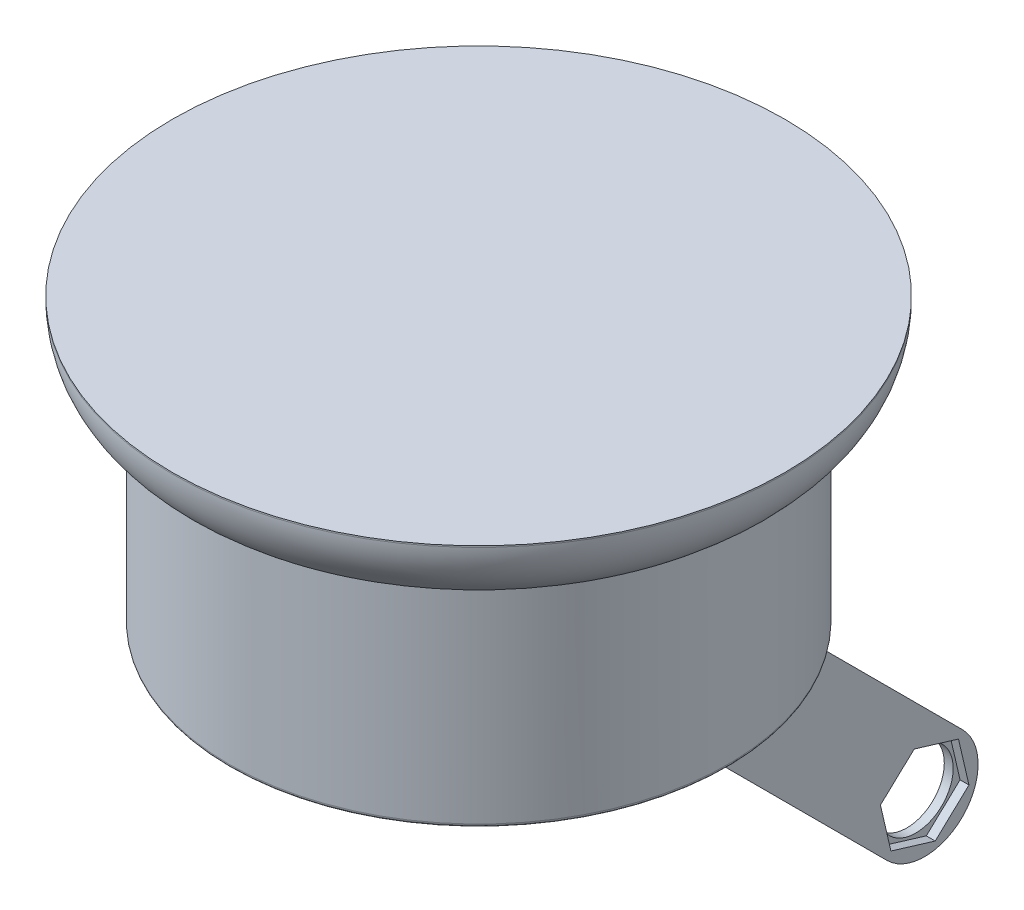
from build123d import *

# Parameters (mm, degrees)
SKETCH2_R                           = 35
BOSS_EXTRUDE2_DEPTH                 = 30
SKETCH4_R                           = 43
BOSS_EXTRUDE3_DEPTH                 = 10
FILLET2_R                           = 10
SKETCH6_W                           = 10
SKETCH6_H                           = 30
EXTRUDE_THIN2_DEPTH                 = 15
SKETCH10_W                          = 10
SKETCH10_H                          = 15
BOSS_EXTRUDE4_DEPTH                 = 30
SKETCH11_W                          = 10
SKETCH11_H                          = 15
BOSS_EXTRUDE5_DEPTH                 = 30
FILLET4_R                           = 1
FILLET5_R                           = 0.5
CUT_EXTRUDE1_DEPTH                  = 127.256815818
CUT_EXTRUDE1_DEPTH_BACK             = 39
SKETCH12_W                          = 7.5
SKETCH12_H                          = 15
CUT_EXTRUDE2_REACH                  = 96.008
SKETCH17_W                          = 7.5
SKETCH17_H                          = 15
CUT_EXTRUDE3_DEPTH                  = 29
CUT_EXTRUDE3_DIRECTION_2_REACH      = 118.906
CUT_EXTRUDE3_DIRECTION_2_END_RADIUS = 7.5
CUT_EXTRUDE4_DEPTH                  = 1.25
SKETCH20_R                          = 2
CUT_EXTRUDE5_DEPTH                  = 1.25
CUT_EXTRUDE7_DEPTH                  = 1.25
SKETCH22_R                          = 5.25
CUT_EXTRUDE8_DEPTH                  = 1.25


with BuildPart() as part:
    # Sketch2 → Boss-Extrude2 (new body)
    with BuildSketch(Plane(origin=(0, 0, 0), x_dir=(1, 0, 0), z_dir=(0, 1, 0))):
        with Locations(Location((0, 0, 0), (0, 0, 270))):
            Circle(SKETCH2_R)
    extrude(amount=BOSS_EXTRUDE2_DEPTH)

    # Sketch4 → Boss-Extrude3 (add)
    with BuildSketch(Plane(origin=(0, 30, 0), x_dir=(1, 0, 0), z_dir=(0, 1, 0))):
        with Locations(Location((0, 0, 0), (0, 0, 270))):
            Circle(SKETCH4_R)
    extrude(amount=BOSS_EXTRUDE3_DEPTH)

    # Fillet2
    # the kernel refuses this fillet: 10 mm, written as the material it takes off along each edge
    with BuildSketch(Plane(origin=(0, 30, 0), x_dir=(0, 0, 1), z_dir=(-1, 0, 0))) as fillet2_piece_1:
        with BuildLine():
            CenterArc((33, 9.797958971), FILLET2_R, 281.536959033, 78.463040967)
            Line((35, 0), (35.04, -0.195959179))
            ThreePointArc((35.04, -0.195959179), (39, -0.2), (43, -0.2))
            Line((43, -0.2), (43.2, 0))
            Line((43.2, 0), (43.2, 9.797958971))
            Line((43.2, 9.797958971), (43, 9.797958971))
        make_face()
    revolve(axis=Axis((0, 30, 0), (0, 1, 0)), mode=Mode.SUBTRACT)

    # Sketch6 → Extrude-Thin2 (add)
    with BuildSketch(Plane(origin=(0, 0, 0), x_dir=(1, 0, 0), z_dir=(0, 0.7071067811865464, -0.7071067811865488))):
        with Locations((17, 15)):
            Rectangle(SKETCH6_W, SKETCH6_H)
        with Locations((-17, 15)):
            Rectangle(SKETCH6_W, SKETCH6_H)
    extrude(amount=EXTRUDE_THIN2_DEPTH)

    # Sketch10 → Boss-Extrude4 (add)
    with BuildSketch(Plane(origin=(0, -21.213203436, -21.213203436), x_dir=(1, 0, 0), z_dir=(0, -0.7071067811865487, -0.7071067811865465))):
        with Locations((17, -7.5)):
            Rectangle(SKETCH10_W, SKETCH10_H)
    extrude(amount=BOSS_EXTRUDE4_DEPTH)

    # Sketch11 → Boss-Extrude5 (add)
    with BuildSketch(Plane(origin=(0, -21.213203436, -21.213203436), x_dir=(1, 0, 0), z_dir=(0, -0.7071067811865487, -0.7071067811865465))):
        with Locations((-17, -7.5)):
            Rectangle(SKETCH11_W, SKETCH11_H)
    extrude(amount=BOSS_EXTRUDE5_DEPTH)

    # Fillet4
    fillet4_edges = [part.edges().sort_by_distance(p)[0] for p in [
        (-12, 0, -10.606601718),
        (-17, 0, -21.213203436),
        (-22, 0, -10.606601718),
        (-17, 0, 0),
        (12, 0, -10.606601718),
        (22, 0, -10.606601718),
        (17, 0, -21.213203436),
        (17, 0, 0),
    ]]
    fillet(fillet4_edges, radius=FILLET4_R)

    # Fillet5
    fillet5_edges = [part.edges().sort_by_distance(p)[0] for p in [
        (0, 0, -35),
    ]]
    fillet(fillet5_edges, radius=FILLET5_R)

    # Sketch12 → Cut-Extrude1 (cut, two sides: drawn at the far end of the back side and taken through both)
    with BuildSketch(Plane(origin=(0, -42.426406871, -42.426406871), x_dir=(1, 0, 0), z_dir=(0, -0.7071067811865485, -0.7071067811865467)).offset(-CUT_EXTRUDE1_DEPTH_BACK)):
        with Locations((-15.75, -7.5)):
            Rectangle(SKETCH12_W, SKETCH12_H)
    extrude(amount=CUT_EXTRUDE1_DEPTH + CUT_EXTRUDE1_DEPTH_BACK, mode=Mode.SUBTRACT)

    # Sketch13 → Cut-Extrude2 (cut, up to next)
    with BuildSketch(Plane.ZY.offset(22), mode=Mode.PRIVATE) as cut_extrude2_sk1:
        with BuildLine():
            Line((-42.426406871, -42.426406871), (-53.033008589, -31.819805153))
            Line((-53.033008589, -31.819805153), (-45.961940777, -24.748737342))
            ThreePointArc((-45.961940777, -24.748737342), (-45.961940777, -35.355339059), (-35.355339059, -35.355339059))
            Line((-35.355339059, -35.355339059), (-42.426406871, -42.426406871))
        make_face()
    cut_extrude2_tool1 = extrude(cut_extrude2_sk1.sketch, amount=-CUT_EXTRUDE2_REACH, mode=Mode.PRIVATE) & part.part
    add(cut_extrude2_tool1.solids().sort_by_distance((-22, -35.429094, -46.035696))[0], mode=Mode.SUBTRACT)
    add(cut_extrude2_tool1.solids().sort_by_distance((-22, -35.429094, -46.035696))[1], mode=Mode.SUBTRACT)

    # Sketch17 → Cut-Extrude3 (cut)
    with BuildSketch(Plane(origin=(0, -35.355339059, -35.355339059), x_dir=(-1, 0, 0), z_dir=(0, -0.7071067811865487, -0.7071067811865465))):
        with Locations((-15.75, 7.5)):
            Rectangle(SKETCH17_W, SKETCH17_H)
    extrude(amount=-CUT_EXTRUDE3_DEPTH, mode=Mode.SUBTRACT)

    # Cut-Extrude3 direction 2: up to this cylinder (the profile starts inside it)
    cut_extrude3_direction_2_end = Plane(origin=(15.75, -30.0520382, -40.658639918), z_dir=(-1, 0, 0)) * Cylinder(CUT_EXTRUDE3_DIRECTION_2_END_RADIUS, 253.812, mode=Mode.PRIVATE)
    # Sketch17 → Cut-Extrude3 direction 2 (cut, up to the surface)
    with BuildSketch(Plane(origin=(0, -35.355339059, -35.355339059), x_dir=(-1, 0, 0), z_dir=(0, -0.7071067811865487, -0.7071067811865465)), mode=Mode.PRIVATE) as cut_extrude3_direction_2_sk1:
        with Locations((-15.75, 7.5)):
            Rectangle(SKETCH17_W, SKETCH17_H)
    cut_extrude3_direction_2_tool1 = extrude(cut_extrude3_direction_2_sk1.sketch, amount=CUT_EXTRUDE3_DIRECTION_2_REACH, mode=Mode.PRIVATE) & cut_extrude3_direction_2_end
    add(cut_extrude3_direction_2_tool1.solids().sort_by_distance((15.75, -30.052038, -40.65864))[0], mode=Mode.SUBTRACT)

    # Sketch18 → Cut-Extrude4 (cut)
    with BuildSketch(Plane.ZY.offset(22)):
        Polygon((-44.309999675, -30.896234088), (-41.753224712, -33.636306452), (-38.101864956, -32.792110564), (-37.007280162, -29.207842313), (-39.564055124, -26.467769949), (-43.215414881, -27.311965837), align=None)
    extrude(amount=-CUT_EXTRUDE4_DEPTH, mode=Mode.SUBTRACT)

    # Sketch20 → Cut-Extrude5 (cut)
    with BuildSketch(Plane.ZY.offset(20.75)):
        with Locations((-40.658639918, -30.0520382)):
            Circle(SKETCH20_R)
    extrude(amount=-CUT_EXTRUDE5_DEPTH, mode=Mode.SUBTRACT)

    # Sketch21 → Cut-Extrude7 (cut)
    with BuildSketch(Plane(origin=(22, 0, 0), x_dir=(0, 0, -1), z_dir=(1, 0, 0))):
        Polygon((34.441125497, -28.162247172), (35.913275669, -34.491668124), (42.130790091, -36.381459152), (46.876154339, -31.941829228), (45.404004167, -25.612408277), (39.186489746, -23.722617249), align=None)
    extrude(amount=-CUT_EXTRUDE7_DEPTH, mode=Mode.SUBTRACT)

    # Sketch22 → Cut-Extrude8 (cut)
    with BuildSketch(Plane(origin=(20.75, 0, 0), x_dir=(0, 0, -1), z_dir=(1, 0, 0))):
        with Locations((40.658639918, -30.0520382)):
            Circle(SKETCH22_R)
    extrude(amount=-CUT_EXTRUDE8_DEPTH, mode=Mode.SUBTRACT)


solid = part.part
